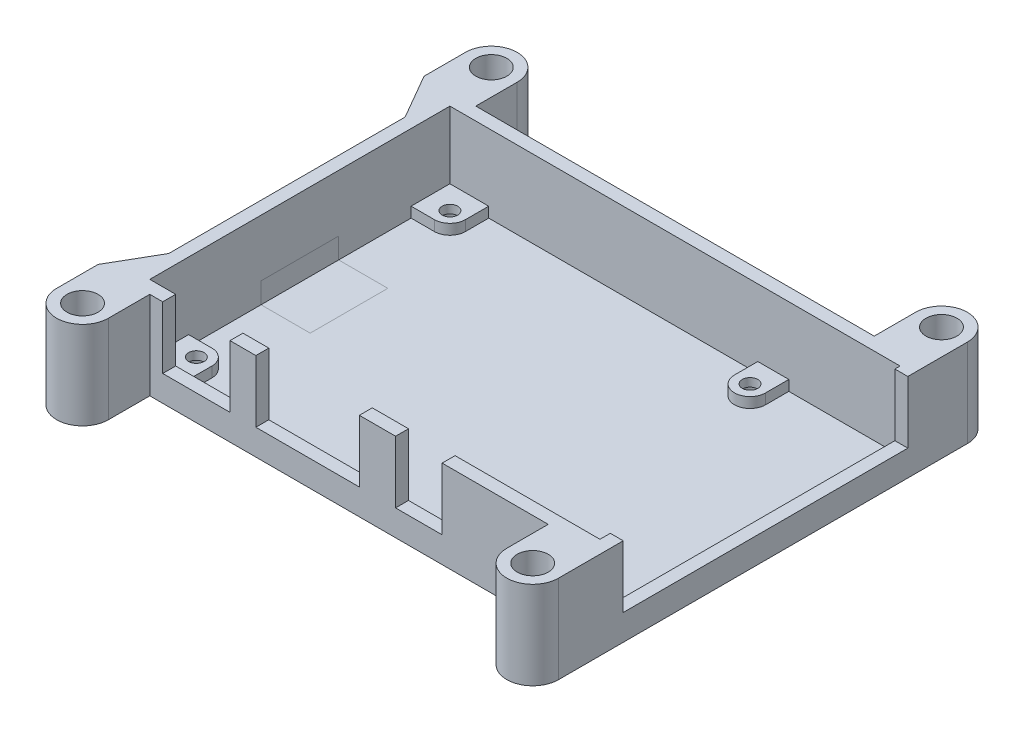
from build123d import *

# Parameters (mm, degrees)
BOSS_EXTRUDE1_DEPTH = 2
BOSS_EXTRUDE2_DEPTH = 2
SKETCH6_W           = 87
SKETCH6_H           = 58.002207555
BOSS_EXTRUDE3_DEPTH = 15
HOLE3_OUTLINE_R     = 1.5
HOLE3_DEPTH         = 4
HOLE4_OUTLINE_R     = 2.8
HOLE4_OUTLINE_R_2   = 1.5
HOLE4_DEPTH         = 2.4
SKETCH9_W           = 15
SKETCH9_H           = 6
CUT_EXTRUDE1_DEPTH  = 12
SKETCH10_W          = 13
SKETCH10_H          = 2.5
SKETCH10_W_2        = 20
SKETCH10_W_3        = 9
SKETCH10_W_4        = 2.5
SKETCH10_H_2        = 55.002207555
CUT_EXTRUDE2_DEPTH  = 12
HOLE5_START         = 7
HOLE5_OUTLINE_R     = 3
HOLE5_DEPTH         = 10
BOSS_EXTRUDE4_START = -7.5
BOSS_EXTRUDE4_DEPTH = 15
SKETCH_1_R          = 1.5
CUT_EXTRUDE_1_DEPTH = 6
SKETCH_2_R          = 2.8
CUT_EXTRUDE_2_DEPTH = 5.8


# Read off the part's stored shape, not the designer's step: Hole3, Hole4, Hole5
with BuildPart() as part:
    # Sketch1 → Boss-Extrude1 (new body)
    with BuildSketch(Plane(origin=(0, 0, 0), x_dir=(1, 0, 0), z_dir=(0, 1, 0))):
        with BuildLine():
            Line((-46, 22.841953517), (-46, -22.841953517))
            Line((-46, -22.841953517), (-51, -31.502207555))
            Line((-51, -31.502207555), (-51, -39.502207555))
            ThreePointArc((-51, -39.502207555), (-46, -44.502207555), (-41, -39.502207555))
            Line((-41, -39.502207555), (-41, -31.502207555))
            Line((-41, -31.502207555), (36, -31.502207555))
            Line((36, -31.502207555), (36, -39.502207555))
            ThreePointArc((36, -39.502207555), (41, -44.502207555), (46, -39.502207555))
            Line((46, -39.502207555), (46, 39.502207555))
            ThreePointArc((46, 39.502207555), (41, 44.502207555), (36, 39.502207555))
            Line((36, 39.502207555), (36, 31.502207555))
            Line((36, 31.502207555), (-41, 31.502207555))
            Line((-41, 31.502207555), (-41, 39.502207555))
            ThreePointArc((-41, 39.502207555), (-46, 44.502207555), (-51, 39.502207555))
            Line((-51, 39.502207555), (-51, 31.502207555))
            Line((-51, 31.502207555), (-46, 22.841953517))
        make_face()
    extrude(amount=BOSS_EXTRUDE1_DEPTH)

    # Sketch2 → Boss-Extrude2 (add)
    with BuildSketch(Plane(origin=(0, 2, 0), x_dir=(1, 0, 0), z_dir=(0, 1, 0))):
        with BuildLine():
            Line((-36, 31.502207555), (-36, 24.5))
            ThreePointArc((-36, 24.5), (-36.878679656, 22.378679656), (-39, 21.5))
            Line((-39, 21.5), (-46, 21.5))
            Line((-46, 21.5), (-46, 31.502207555))
            Line((-46, 31.502207555), (-36, 31.502207555))
        make_face()
        with BuildLine():
            Line((16, 31.502207555), (16, 24.502207555))
            ThreePointArc((16, 24.502207555), (19, 21.502207555), (22, 24.502207555))
            Line((22, 24.502207555), (22, 31.502207555))
            Line((22, 31.502207555), (16, 31.502207555))
        make_face()
        with BuildLine():
            Line((-36, -31.502207555), (-46, -31.502207555))
            Line((-46, -31.502207555), (-46, -21.502207555))
            Line((-46, -21.502207555), (-39, -21.502207555))
            ThreePointArc((-39, -21.502207555), (-36.878679656, -22.380887212), (-36, -24.502207555))
            Line((-36, -24.502207555), (-36, -31.502207555))
        make_face()
        with BuildLine():
            Line((16, -31.502207555), (16, -24.502207555))
            ThreePointArc((16, -24.502207555), (19, -21.502207555), (22, -24.502207555))
            Line((22, -24.502207555), (22, -31.502207555))
            Line((22, -31.502207555), (16, -31.502207555))
        make_face()
    extrude(amount=BOSS_EXTRUDE2_DEPTH)

    # Sketch6 → Boss-Extrude3 (add)
    with BuildSketch(Plane(origin=(0, 2, 0), x_dir=(1, 0, 0), z_dir=(0, 1, 0))):
        with BuildLine():
            Line((-46, -22.841953517), (-51, -31.502207555))
            Line((-51, -31.502207555), (-51, -39.502207555))
            ThreePointArc((-51, -39.502207555), (-46, -44.502207555), (-41, -39.502207555))
            Line((-41, -39.502207555), (-41, -31.502207555))
            Line((-41, -31.502207555), (36, -31.502207555))
            Line((36, -31.502207555), (36, -39.502207555))
            ThreePointArc((36, -39.502207555), (41, -44.502207555), (46, -39.502207555))
            Line((46, -39.502207555), (46, 39.502207555))
            ThreePointArc((46, 39.502207555), (41, 44.502207555), (36, 39.502207555))
            Line((36, 39.502207555), (36, 31.502207555))
            Line((36, 31.502207555), (-41, 31.502207555))
            Line((-41, 31.502207555), (-41, 39.502207555))
            ThreePointArc((-41, 39.502207555), (-46, 44.502207555), (-51, 39.502207555))
            Line((-51, 39.502207555), (-51, 31.502207555))
            Line((-51, 31.502207555), (-46, 22.841953517))
            Line((-46, 22.841953517), (-46, -22.841953517))
        make_face()
        with Locations((0, -0.001103777)):
            Rectangle(SKETCH6_W, SKETCH6_H, mode=Mode.SUBTRACT)
    extrude(amount=BOSS_EXTRUDE3_DEPTH)

    # Hole3 outline → Hole3 (cut)
    with BuildSketch(Plane(origin=(0, 0, 0), x_dir=(1, 0, 0), z_dir=(0, 1, 0))):
        with Locations((-39, 24.5)):
            Circle(HOLE3_OUTLINE_R)
        with Locations((19, 24.502207555)):
            Circle(HOLE3_OUTLINE_R)
        with Locations((-39, -24.502207555)):
            Circle(HOLE3_OUTLINE_R)
        with Locations((19, -24.502207555)):
            Circle(HOLE3_OUTLINE_R)
    extrude(amount=HOLE3_DEPTH, mode=Mode.SUBTRACT)

    # Hole4 outline → Hole4 (cut)
    # profile 1 of 4: a face of its own
    with BuildSketch(Plane(origin=(0, 0, 0), x_dir=(1, 0, 0), z_dir=(0, 1, 0))):
        with Locations((19, 24.502207555)):
            Circle(HOLE4_OUTLINE_R)
        with Locations((19, 24.502207555)):
            Circle(HOLE4_OUTLINE_R_2, mode=Mode.SUBTRACT)
    # profile 2 of 4: a face of its own
    with BuildSketch(Plane(origin=(0, 0, 0), x_dir=(1, 0, 0), z_dir=(0, 1, 0))):
        with Locations((19, -24.502207555)):
            Circle(HOLE4_OUTLINE_R)
        with Locations((19, -24.502207555)):
            Circle(HOLE4_OUTLINE_R_2, mode=Mode.SUBTRACT)
    # profile 3 of 4: a face of its own
    with BuildSketch(Plane(origin=(0, 0, 0), x_dir=(1, 0, 0), z_dir=(0, 1, 0))):
        with Locations((-39, -24.502207555)):
            Circle(HOLE4_OUTLINE_R)
        with Locations((-39, -24.502207555)):
            Circle(HOLE4_OUTLINE_R_2, mode=Mode.SUBTRACT)
    # profile 4 of 4: a face of its own
    with BuildSketch(Plane(origin=(0, 0, 0), x_dir=(1, 0, 0), z_dir=(0, 1, 0))):
        with Locations((-39, 24.5)):
            Circle(HOLE4_OUTLINE_R)
        with Locations((-39, 24.5)):
            Circle(HOLE4_OUTLINE_R_2, mode=Mode.SUBTRACT)
    extrude(amount=HOLE4_DEPTH, mode=Mode.SUBTRACT)

    # Sketch9 → Cut-Extrude1 (cut)
    with BuildSketch(Plane.ZY.offset(46)):
        with Locations((0, 3)):
            Rectangle(SKETCH9_W, SKETCH9_H)
    extrude(amount=-CUT_EXTRUDE1_DEPTH, mode=Mode.SUBTRACT)

    # Sketch10 → Cut-Extrude2 (cut)
    with BuildSketch(Plane(origin=(0, 17, 0), x_dir=(1, 0, 0), z_dir=(0, 1, 0))):
        with Locations((-32, -30.252207555)):
            Rectangle(SKETCH10_W, SKETCH10_H)
        with Locations((-10.5, -30.252207555)):
            Rectangle(SKETCH10_W_2, SKETCH10_H)
        with Locations((11, -30.252207555)):
            Rectangle(SKETCH10_W_3, SKETCH10_H)
        with Locations((44.75, 0.498896222)):
            Rectangle(SKETCH10_W_4, SKETCH10_H_2)
    extrude(amount=-CUT_EXTRUDE2_DEPTH, mode=Mode.SUBTRACT)

    # Hole5 outline → Hole5 (cut)
    with BuildSketch(Plane(origin=(0, 0, 0), x_dir=(1, 0, 0), z_dir=(0, 1, 0)).offset(HOLE5_START)):
        with Locations((-46, -39.502207555)):
            Circle(HOLE5_OUTLINE_R)
        with Locations((41, 39.502207555)):
            Circle(HOLE5_OUTLINE_R)
        with Locations((-46, 39.502207555)):
            Circle(HOLE5_OUTLINE_R)
        with Locations((41, -39.502207555)):
            Circle(HOLE5_OUTLINE_R)
    extrude(amount=HOLE5_DEPTH, mode=Mode.SUBTRACT)

    # 草图1 → 切除-拉伸1 (cut)
    with BuildSketch(Plane(origin=(0, 7, 0), x_dir=(1, 0, 0), z_dir=(0, 1, 0))):
        with Locations(Location((-46, 39.502207555, 0), (0, 0, 270))):
            Circle(SKETCH_1_R)
        with Locations(Location((41, 39.502207555, 0), (0, 0, 270))):
            Circle(SKETCH_1_R)
        with Locations(Location((41, -39.502207555, 0), (0, 0, 270))):
            Circle(SKETCH_1_R)
        with Locations(Location((-46, -39.502207555, 0), (0, 0, 270))):
            Circle(SKETCH_1_R)
    extrude(amount=-CUT_EXTRUDE_1_DEPTH, mode=Mode.SUBTRACT)

    # 草图2 → 切除-拉伸2 (cut)
    with BuildSketch(Plane.XZ):
        with Locations(Location((41, -39.502207555, 0), (0, 0, 270))):
            Circle(SKETCH_2_R)
        with Locations(Location((41, 39.502207555, 0), (0, 0, 270))):
            Circle(SKETCH_2_R)
        with Locations(Location((-46, 39.502207555, 0), (0, 0, 270))):
            Circle(SKETCH_2_R)
        with Locations(Location((-46, -39.502207555, 0), (0, 0, 270))):
            Circle(SKETCH_2_R)
    extrude(amount=-CUT_EXTRUDE_2_DEPTH, mode=Mode.SUBTRACT)


with BuildPart() as body_2:
    # Sketch12 → Boss-Extrude4 (new body)
    with BuildSketch(Plane.XY.offset(BOSS_EXTRUDE4_START)):
        Polygon((-46, 6), (-46, 0), (-34, 0), (-34, 2), (-43.5, 2), (-43.5, 6), align=None)
    extrude(amount=BOSS_EXTRUDE4_DEPTH)


solid = Compound([part.part, body_2.part])
